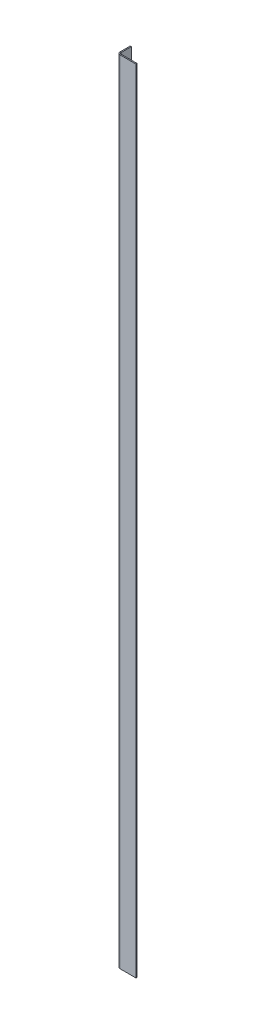
from build123d import *

# Parameters (mm, degrees)
BASE_FLANGE1_DEPTH = 1727.2


# Sheet-metal steps are written as plain solids
with BuildPart() as part:
    # Sketch1 → Base-Flange1 (new body)
    with BuildSketch(Plane(origin=(0, 0, 0), x_dir=(1, 0, 0), z_dir=(0, 1, 0))):
        with BuildLine():
            Line((20.820919871, -27.761226495), (-14.104080129, -27.761226495))
            ThreePointArc((-14.104080129, -27.761226495), (-16.349144159, -26.831290525), (-17.279080129, -24.586226495))
            Line((-17.279080129, -24.586226495), (-17.279080129, -2.361226495))
            Line((-17.279080129, -2.361226495), (-19.660330129, -2.361226495))
            Line((-19.660330129, -2.361226495), (-19.660330129, -24.586226495))
            ThreePointArc((-19.660330129, -24.586226495), (-18.032942182, -28.515088548), (-14.104080129, -30.142476495))
            Line((-14.104080129, -30.142476495), (20.820919871, -30.142476495))
            Line((20.820919871, -30.142476495), (20.820919871, -27.761226495))
        make_face()
    extrude(amount=BASE_FLANGE1_DEPTH)


solid = part.part
